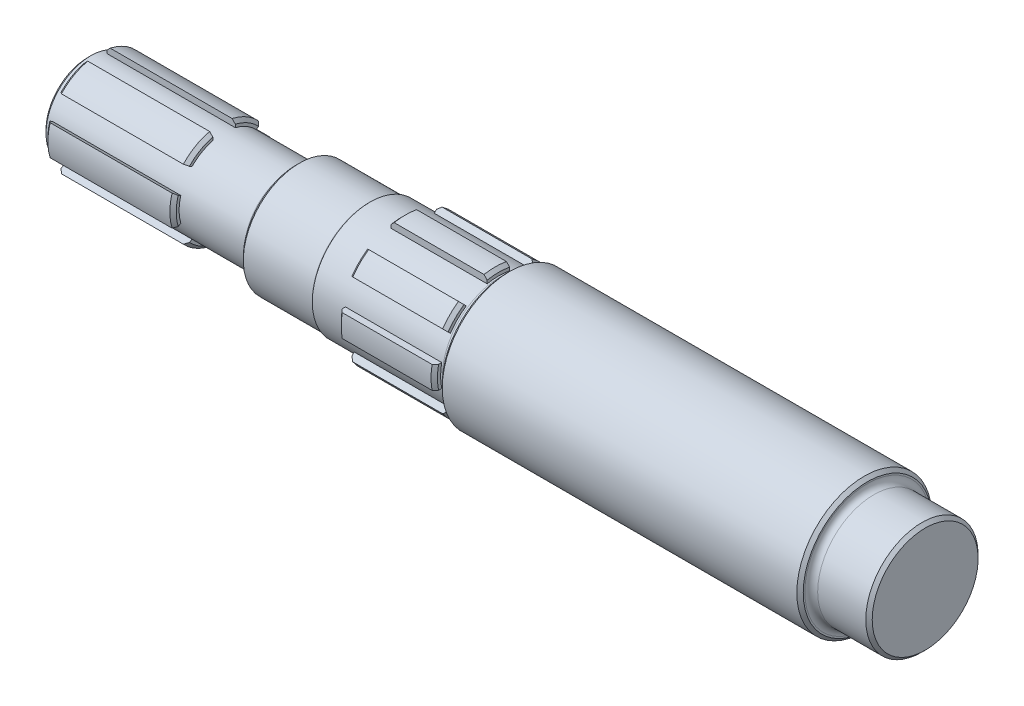
from build123d import *
from build123d.topology import SkipClean

# Parameters (mm, degrees)
SKETCH2_R           = 14
BOSS_EXTRUDE1_DEPTH = 65
CUT_EXTRUDE1_START  = -30
CUT_EXTRUDE1_DEPTH  = 30
FILLET1_R           = 2
FILLET2_R           = 2
FILLET3_R           = 0.5
CHAMFER1_SIZE       = 1
BOSS_EXTRUDE4_START = -40
BOSS_EXTRUDE4_DEPTH = 40
CHAMFER3_SIZE       = 1
CHAMFER4_SIZE       = 1
FILLET4_R           = 2
CHAMFER5_SIZE       = 1
CHAMFER6_SIZE       = 1
CHAMFER7_SIZE       = 1
CHAMFER8_SIZE       = 1


# Some blends are built 0.0001 mm under size
with BuildPart() as part:
    # Sketch1 → Revolve1 (revolve)
    with BuildSketch(Plane.XY, mode=Mode.PRIVATE) as revolve1_sk:
        Polygon((-80.515695067, 0), (-80.515695067, 17.5), (-57.515695067, 17.5), (-57.515695067, 18), (-47.515695067, 18), (-47.515695067, 20), (-17.515695067, 20), (-17.515695067, 18), (-15.015695067, 18), (-15.015695067, 21), (97.484304933, 21), (97.484304933, 17.5), (115.484304933, 17.5), (115.484304933, 0), align=None)
    revolve(revolve1_sk.sketch.rotate(Axis((-88.520179372, 0, 0), (1, 0, 0)), 90), axis=Axis((-88.520179372, 0, 0), (1, 0, 0)))

    # Sketch2 → Boss-Extrude1 (add)
    with BuildSketch(Plane.ZY.offset(80.515695067)):
        Circle(SKETCH2_R)
    extrude(amount=BOSS_EXTRUDE1_DEPTH)

    # Sketch3 → Cut-Extrude1 (cut)
    with SkipClean():  # the faces are left unmerged after this step: merging them gives an invalid solid
        with BuildSketch(Plane.ZY.offset(47.515695067).offset(CUT_EXTRUDE1_START)):
            with BuildLine():
                Line((3.5, 19.691368668), (3.5, 17.656443583))
                ThreePointArc((3.5, 17.656443583), (6.888301783, 16.629831585), (10.010117255, 14.959864723))
                Line((10.010117255, 14.959864723), (11.449026581, 16.39877405))
                ThreePointArc((11.449026581, 16.39877405), (7.653668647, 18.47759065), (3.5, 19.691368668))
            make_face()
            with BuildLine():
                Line((-3.5, 19.691368668), (-3.5, 17.656443583))
                ThreePointArc((-3.5, 17.656443583), (-6.888301783, 16.629831585), (-10.010117255, 14.959864723))
                Line((-10.010117255, 14.959864723), (-11.449026581, 16.39877405))
                ThreePointArc((-11.449026581, 16.39877405), (-7.653668647, 18.47759065), (-3.5, 19.691368668))
            make_face()
            with BuildLine():
                Line((16.39877405, 11.449026581), (14.959864723, 10.010117255))
                ThreePointArc((14.959864723, 10.010117255), (16.629831585, 6.888301783), (17.656443583, 3.5))
                Line((17.656443583, 3.5), (19.691368668, 3.5))
                ThreePointArc((19.691368668, 3.5), (18.47759065, 7.653668647), (16.39877405, 11.449026581))
            make_face()
            with BuildLine():
                Line((19.691368668, -3.5), (17.656443583, -3.5))
                ThreePointArc((17.656443583, -3.5), (16.629831585, -6.888301783), (14.959864723, -10.010117255))
                Line((14.959864723, -10.010117255), (16.39877405, -11.449026581))
                ThreePointArc((16.39877405, -11.449026581), (18.47759065, -7.653668647), (19.691368668, -3.5))
            make_face()
            with BuildLine():
                Line((11.449026581, -16.39877405), (10.010117255, -14.959864723))
                ThreePointArc((10.010117255, -14.959864723), (6.888301783, -16.629831585), (3.5, -17.656443583))
                Line((3.5, -17.656443583), (3.5, -19.691368668))
                ThreePointArc((3.5, -19.691368668), (7.653668647, -18.47759065), (11.449026581, -16.39877405))
            make_face()
            with BuildLine():
                Line((-3.5, -19.691368668), (-3.5, -17.656443583))
                ThreePointArc((-3.5, -17.656443583), (-6.888301783, -16.629831585), (-10.010117255, -14.959864723))
                Line((-10.010117255, -14.959864723), (-11.449026581, -16.39877405))
                ThreePointArc((-11.449026581, -16.39877405), (-7.653668647, -18.47759065), (-3.5, -19.691368668))
            make_face()
            with BuildLine():
                Line((-16.39877405, -11.449026581), (-14.959864723, -10.010117255))
                ThreePointArc((-14.959864723, -10.010117255), (-16.629831585, -6.888301783), (-17.656443583, -3.5))
                Line((-17.656443583, -3.5), (-19.691368668, -3.5))
                ThreePointArc((-19.691368668, -3.5), (-18.47759065, -7.653668647), (-16.39877405, -11.449026581))
            make_face()
            with BuildLine():
                Line((-19.691368668, 3.5), (-17.656443583, 3.5))
                ThreePointArc((-17.656443583, 3.5), (-16.629831585, 6.888301783), (-14.959864723, 10.010117255))
                Line((-14.959864723, 10.010117255), (-16.39877405, 11.449026581))
                ThreePointArc((-16.39877405, 11.449026581), (-18.47759065, 7.653668647), (-19.691368668, 3.5))
            make_face()
        extrude(amount=CUT_EXTRUDE1_DEPTH, mode=Mode.SUBTRACT)

    # Fillet1
    fillet1_edges = [part.edges().sort_by_distance(p)[0] for p in [
        (-15.015695067, 0, -18),
    ]]
    fillet(fillet1_edges, radius=FILLET1_R)

    # Fillet2
    fillet2_edges = [part.edges().sort_by_distance(p)[0] for p in [
        (97.484304933, 0, -17.5),
    ]]
    fillet(fillet2_edges, radius=FILLET2_R)

    # Fillet3
    fillet3_edges = [part.edges().sort_by_distance(p)[0] for p in [
        (-57.515695067, 0, -17.5),
    ]]
    fillet(fillet3_edges, radius=FILLET3_R - 0.0001)  # a hair under: the kernel refuses the full size

    # Chamfer1
    # the kernel refuses this chamfer: 1 mm, written as the material it adds along each edge
    with BuildSketch(Plane(origin=(-47.515695067, 0, 0), x_dir=(0, -0.9018204350673957, -0.43211098446446955), z_dir=(0, -0.43211098446446955, 0.9018204350673957))) as chamfer1_piece_1_section:
        Polygon((18, -CHAMFER1_SIZE), (18 + CHAMFER1_SIZE, 0), (18, 0), align=None)
    chamfer1_piece_1 = revolve(axis=Axis((-47.515695067, 0, 0), (1, 0, 0)), revolution_arc=38.796793403, mode=Mode.PRIVATE)
    chamfer1_piece_1 = split(chamfer1_piece_1, bisect_by=Plane(origin=(-47.84551159, -15.3563585, -10.406611032), z_dir=(0, 0.7071067811865462, -0.7071067811865489)), keep=Keep.TOP, mode=Mode.PRIVATE)
    chamfer1_piece_1 = split(chamfer1_piece_1, bisect_by=Plane(origin=(-47.84551159, -10.406611032, -15.3563585), z_dir=(0, -0.7071067811865492, 0.7071067811865458)), keep=Keep.TOP, mode=Mode.PRIVATE)
    add(chamfer1_piece_1)
    # the kernel refuses this chamfer: 1 mm, written as the material it takes off along each edge
    with BuildSketch(Plane(origin=(-17.515695067, 0, 0), x_dir=(0, 0.8865763462424374, 0.46258229784916083), z_dir=(0, 0.46258229784916083, -0.8865763462424374))) as chamfer1_2_piece_1:
        Polygon((20, -CHAMFER1_SIZE), (20 - CHAMFER1_SIZE, 0), (20, 0), align=None)
    revolve(axis=Axis((-17.515695067, 0, 0), (1, 0, 0)), revolution_arc=34.892271196, mode=Mode.SUBTRACT)
    with BuildSketch(Plane(origin=(-17.515695067, 0, 0), x_dir=(0, 0.9539992261336169, -0.29980906680162295), z_dir=(0, -0.29980906680162295, -0.9539992261336169))) as chamfer1_2_piece_2:
        Polygon((20, -CHAMFER1_SIZE), (20 - CHAMFER1_SIZE, 0), (20, 0), align=None)
    revolve(axis=Axis((-17.515695067, 0, 0), (1, 0, 0)), revolution_arc=34.892271196, mode=Mode.SUBTRACT)
    with BuildSketch(Plane(origin=(-17.515695067, 0, 0), x_dir=(0, 0.46258229784916044, -0.8865763462424375), z_dir=(0, -0.8865763462424375, -0.46258229784916044))) as chamfer1_2_piece_3:
        Polygon((20, -CHAMFER1_SIZE), (20 - CHAMFER1_SIZE, 0), (20, 0), align=None)
    revolve(axis=Axis((-17.515695067, 0, 0), (1, 0, 0)), revolution_arc=34.892271196, mode=Mode.SUBTRACT)
    with BuildSketch(Plane(origin=(-17.515695067, 0, 0), x_dir=(0, -0.2998090668016235, -0.9539992261336169), z_dir=(0, -0.9539992261336169, 0.2998090668016235))) as chamfer1_2_piece_4:
        Polygon((20, -CHAMFER1_SIZE), (20 - CHAMFER1_SIZE, 0), (20, 0), align=None)
    revolve(axis=Axis((-17.515695067, 0, 0), (1, 0, 0)), revolution_arc=34.892271196, mode=Mode.SUBTRACT)
    with BuildSketch(Plane(origin=(-17.515695067, 0, 0), x_dir=(0, -0.8865763462424375, -0.46258229784916055), z_dir=(0, -0.46258229784916055, 0.8865763462424375))) as chamfer1_2_piece_5:
        Polygon((20 - CHAMFER1_SIZE, 0), (20, -CHAMFER1_SIZE), (20, 0), align=None)
    revolve(axis=Axis((-17.515695067, 0, 0), (1, 0, 0)), revolution_arc=34.892271196, mode=Mode.SUBTRACT)
    with BuildSketch(Plane(origin=(-17.515695067, 0, 0), x_dir=(0, -0.953999226133617, 0.29980906680162295), z_dir=(0, 0.29980906680162295, 0.953999226133617))) as chamfer1_2_piece_6:
        Polygon((20, -CHAMFER1_SIZE), (20 - CHAMFER1_SIZE, 0), (20, 0), align=None)
    revolve(axis=Axis((-17.515695067, 0, 0), (1, 0, 0)), revolution_arc=34.892271196, mode=Mode.SUBTRACT)
    with BuildSketch(Plane(origin=(-17.515695067, 0, 0), x_dir=(0, -0.46258229784916055, 0.8865763462424375), z_dir=(0, 0.8865763462424375, 0.46258229784916055))) as chamfer1_2_piece_7:
        Polygon((20, -CHAMFER1_SIZE), (20 - CHAMFER1_SIZE, 0), (20, 0), align=None)
    revolve(axis=Axis((-17.515695067, 0, 0), (1, 0, 0)), revolution_arc=34.892271196, mode=Mode.SUBTRACT)
    with BuildSketch(Plane(origin=(-17.515695067, 0, 0), x_dir=(0, 0.2998072133832852, 0.9539998085971242), z_dir=(0, 0.9539998085971242, -0.2998072133832852))) as chamfer1_2_piece_8:
        Polygon((20, -CHAMFER1_SIZE), (20 - CHAMFER1_SIZE, 0), (20, 0), align=None)
    revolve(axis=Axis((-17.515695067, 0, 0), (1, 0, 0)), revolution_arc=17.446024285, mode=Mode.SUBTRACT)
    with BuildSketch(Plane(origin=(-47.515695067, 0, 0), x_dir=(0, 0.8865763462424378, 0.46258229784916), z_dir=(0, 0.46258229784916, -0.8865763462424378))) as chamfer1_2_piece_9:
        Polygon((20 - CHAMFER1_SIZE, 0), (20, CHAMFER1_SIZE), (20, 0), align=None)
    revolve(axis=Axis((-47.515695067, 0, 0), (1, 0, 0)), revolution_arc=34.892271196, mode=Mode.SUBTRACT)
    with BuildSketch(Plane(origin=(-47.515695067, 0, 0), x_dir=(0, 0.9539992261336167, -0.2998090668016239), z_dir=(0, -0.2998090668016239, -0.9539992261336167))) as chamfer1_2_piece_10:
        Polygon((20 - CHAMFER1_SIZE, 0), (20, CHAMFER1_SIZE), (20, 0), align=None)
    revolve(axis=Axis((-47.515695067, 0, 0), (1, 0, 0)), revolution_arc=34.892271196, mode=Mode.SUBTRACT)
    with BuildSketch(Plane(origin=(-47.515695067, 0, 0), x_dir=(0, 0.4625822978491601, -0.8865763462424378), z_dir=(0, -0.8865763462424378, -0.4625822978491601))) as chamfer1_2_piece_11:
        Polygon((20 - CHAMFER1_SIZE, 0), (20, CHAMFER1_SIZE), (20, 0), align=None)
    revolve(axis=Axis((-47.515695067, 0, 0), (1, 0, 0)), revolution_arc=34.892271196, mode=Mode.SUBTRACT)
    with BuildSketch(Plane(origin=(-47.515695067, 0, 0), x_dir=(0, -0.2998090668016239, -0.9539992261336167), z_dir=(0, -0.9539992261336167, 0.2998090668016239))) as chamfer1_2_piece_12:
        Polygon((20 - CHAMFER1_SIZE, 0), (20, CHAMFER1_SIZE), (20, 0), align=None)
    revolve(axis=Axis((-47.515695067, 0, 0), (1, 0, 0)), revolution_arc=34.892271196, mode=Mode.SUBTRACT)
    with BuildSketch(Plane(origin=(-47.515695067, 0, 0), x_dir=(0, -0.9539992261336169, 0.2998090668016234), z_dir=(0, 0.2998090668016234, 0.9539992261336169))) as chamfer1_2_piece_13:
        Polygon((20 - CHAMFER1_SIZE, 0), (20, CHAMFER1_SIZE), (20, 0), align=None)
    revolve(axis=Axis((-47.515695067, 0, 0), (1, 0, 0)), revolution_arc=34.892271196, mode=Mode.SUBTRACT)
    with BuildSketch(Plane(origin=(-47.515695067, 0, 0), x_dir=(0, -0.46258229784916033, 0.8865763462424378), z_dir=(0, 0.8865763462424378, 0.46258229784916033))) as chamfer1_2_piece_14:
        Polygon((20 - CHAMFER1_SIZE, 0), (20, CHAMFER1_SIZE), (20, 0), align=None)
    revolve(axis=Axis((-47.515695067, 0, 0), (1, 0, 0)), revolution_arc=34.892271196, mode=Mode.SUBTRACT)
    with BuildSketch(Plane(origin=(-47.515695067, 0, 0), x_dir=(0, 0.2998072133832852, 0.9539998085971242), z_dir=(0, 0.9539998085971242, -0.2998072133832852))) as chamfer1_2_piece_15:
        Polygon((20 - CHAMFER1_SIZE, 0), (20, CHAMFER1_SIZE), (20, 0), align=None)
    revolve(axis=Axis((-47.515695067, 0, 0), (1, 0, 0)), revolution_arc=17.446024285, mode=Mode.SUBTRACT)
    with BuildSketch(Plane(origin=(-47.515695067, 0, 0), x_dir=(0, 0, 1), z_dir=(0, 1, 0))) as chamfer1_2_piece_16:
        Polygon((20 - CHAMFER1_SIZE, 0), (20, CHAMFER1_SIZE), (20, 0), align=None)
    revolve(axis=Axis((-47.515695067, 0, 0), (1, 0, 0)), revolution_arc=17.446024285, mode=Mode.SUBTRACT)
    with BuildSketch(Plane(origin=(-17.515695067, 0, 0), x_dir=(0, 0, 1), z_dir=(0, 1, 0))) as chamfer1_2_piece_17:
        Polygon((20, -CHAMFER1_SIZE), (20 - CHAMFER1_SIZE, 0), (20, 0), align=None)
    revolve(axis=Axis((-17.515695067, 0, 0), (1, 0, 0)), revolution_arc=17.446024285, mode=Mode.SUBTRACT)

    # Sketch6 → Boss-Extrude4 (add)
    with BuildSketch(Plane.ZY.offset(143.015695067).offset(BOSS_EXTRUDE4_START)):
        with BuildLine():
            Line((-3.5, 13.555441712), (-3.5, 15.52484125))
            ThreePointArc((-3.5, 15.52484125), (-7.957240348, 13.782344571), (-11.694906912, 10.793509538))
            Line((-11.694906912, 10.793509538), (-9.989356882, 9.808809769))
            ThreePointArc((-9.989356882, 9.808809769), (-7, 12.124355653), (-3.5, 13.555441712))
        make_face()
        with BuildLine():
            Line((9.989356882, 9.808809769), (11.694906912, 10.793509538))
            ThreePointArc((11.694906912, 10.793509538), (7.957240348, 13.782344571), (3.5, 15.52484125))
            Line((3.5, 15.52484125), (3.5, 13.555441712))
            ThreePointArc((3.5, 13.555441712), (7, 12.124355653), (9.989356882, 9.808809769))
        make_face()
        with BuildLine():
            Line((15.194906912, 4.731331712), (13.489356882, 3.746631943))
            ThreePointArc((13.489356882, 3.746631943), (14, 0), (13.489356882, -3.746631943))
            Line((13.489356882, -3.746631943), (15.194906912, -4.731331712))
            ThreePointArc((15.194906912, -4.731331712), (15.914480697, 0), (15.194906912, 4.731331712))
        make_face()
        with BuildLine():
            Line((11.694906912, -10.793509538), (9.989356882, -9.808809769))
            ThreePointArc((9.989356882, -9.808809769), (7, -12.124355653), (3.5, -13.555441712))
            Line((3.5, -13.555441712), (3.5, -15.52484125))
            ThreePointArc((3.5, -15.52484125), (7.957240348, -13.782344571), (11.694906912, -10.793509538))
        make_face()
        with BuildLine():
            Line((-3.5, -15.52484125), (-3.5, -13.555441712))
            ThreePointArc((-3.5, -13.555441712), (-7, -12.124355653), (-9.989356882, -9.808809769))
            Line((-9.989356882, -9.808809769), (-11.694906912, -10.793509538))
            ThreePointArc((-11.694906912, -10.793509538), (-7.957240348, -13.782344571), (-3.5, -15.52484125))
        make_face()
        with BuildLine():
            Line((-15.194906912, -4.731331712), (-13.489356882, -3.746631943))
            ThreePointArc((-13.489356882, -3.746631943), (-14, 0), (-13.489356882, 3.746631943))
            Line((-13.489356882, 3.746631943), (-15.194906912, 4.731331712))
            ThreePointArc((-15.194906912, 4.731331712), (-15.914480697, 0), (-15.194906912, -4.731331712))
        make_face()
    extrude(amount=BOSS_EXTRUDE4_DEPTH)

    # Chamfer3
    chamfer3_edges = [part.edges().sort_by_distance(p)[0] for p in [
        (-103.015695067, 13.782344571, -7.957240348),
        (-143.015695067, 13.782344571, -7.957240348),
        (-103.015695067, 13.782344571, 7.957240348),
        (-143.015695067, 13.782344571, 7.957240348),
        (-103.015695067, 0, 15.914480697),
        (-143.015695067, 0, 15.914480697),
        (-103.015695067, -13.782344571, 7.957240348),
        (-143.015695067, -13.782344571, 7.957240348),
        (-103.015695067, -13.782344571, -7.957240348),
        (-143.015695067, -13.782344571, -7.957240348),
        (-103.015695067, 0, -15.914480697),
        (-143.015695067, 0, -15.914480697),
    ]]
    chamfer(chamfer3_edges, length=CHAMFER3_SIZE)

    # Chamfer4
    chamfer4_edges = [part.edges().sort_by_distance(p)[0] for p in [
        (-80.515695067, 0, -17.5),
    ]]
    chamfer(chamfer4_edges, length=CHAMFER4_SIZE)

    # Fillet4
    fillet4_edges = [part.edges().sort_by_distance(p)[0] for p in [
        (-80.515695067, 0, -14),
    ]]
    fillet(fillet4_edges, radius=FILLET4_R)

    # Chamfer5
    chamfer5_edges = [part.edges().sort_by_distance(p)[0] for p in [
        (-15.015695067, 0, -21),
    ]]
    chamfer(chamfer5_edges, length=CHAMFER5_SIZE - 0.0001)  # a hair under: the kernel refuses the full size

    # Chamfer6
    chamfer6_edges = [part.edges().sort_by_distance(p)[0] for p in [
        (-145.515695067, 0, -14),
    ]]
    chamfer(chamfer6_edges, length=CHAMFER6_SIZE)

    # Chamfer7
    chamfer7_edges = [part.edges().sort_by_distance(p)[0] for p in [
        (97.484304933, 0, -21),
    ]]
    chamfer(chamfer7_edges, length=CHAMFER7_SIZE)

    # Chamfer8
    chamfer8_edges = [part.edges().sort_by_distance(p)[0] for p in [
        (115.484304933, 0, -17.5),
    ]]
    chamfer(chamfer8_edges, length=CHAMFER8_SIZE)


solid = part.part
